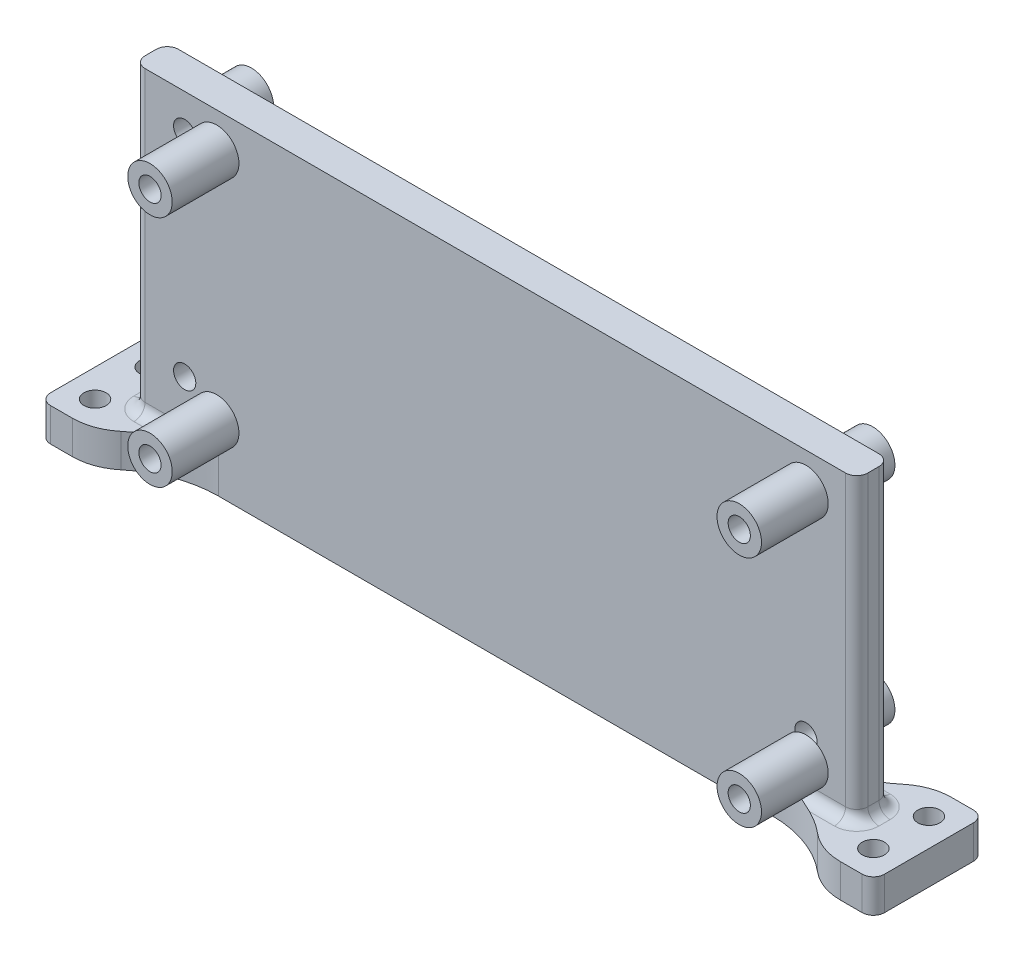
from build123d import *

# Parameters (mm, degrees)
SKETCH2_W           = 65
SKETCH2_H           = 30.000000000000004
BOSS_EXTRUDE1_DEPTH = 3
SKETCH3_R           = 0.9999999999999981
SKETCH3_R_2         = 0.9999999999999983
SKETCH3_R_3         = 1.0000000000000002
BOSS_EXTRUDE2_DEPTH = 3
FILLET1_R           = 10
FILLET2_R           = 1
FILLET3_R           = 1
FILLET4_R           = 5
SKETCH4_R           = 1.0000000000000004
SKETCH4_R_2         = 0.9999999999999983
CUT_EXTRUDE1_DEPTH  = 10
BOSS_EXTRUDE3_START = 3
SKETCH5_R           = 2.000000000000001
SKETCH5_R_2         = 1.0000000000000004
SKETCH5_R_3         = 2.0000000000000004
SKETCH5_R_4         = 1.0000000000000009
SKETCH5_R_5         = 2.0000000000000036
SKETCH5_R_6         = 1.000000000000005
SKETCH5_R_7         = 2.0000000000000027
SKETCH5_R_8         = 0.9999999999999983
BOSS_EXTRUDE3_DEPTH = 3
SKETCH6_R           = 2.0000000000000036
SKETCH6_R_2         = 0.9999999999999983
SKETCH6_R_3         = 2.000000000000003
SKETCH6_R_4         = 0.9999999999999981
SKETCH6_R_5         = 2
SKETCH6_R_6         = 1.0000000000000018
SKETCH6_R_7         = 1.9999999999999987
SKETCH6_R_8         = 1.0000000000000007
BOSS_EXTRUDE4_DEPTH = 6


with BuildPart() as part:
    # Sketch2 → Boss-Extrude1 (new body)
    with BuildSketch(Plane.XY):
        with Locations((32.5, 15.000000000000002)):
            Rectangle(SKETCH2_W, SKETCH2_H)
    extrude(amount=BOSS_EXTRUDE1_DEPTH)

    # Sketch3 → Boss-Extrude2 (add)
    # profile 1 of 2: a face of its own
    with BuildSketch(Plane.XZ):
        Polygon((65, 1.5), (65, 6.500000000000001), (70, 6.500000000000001), (70, -3.4999999999999996), (65, -3.4999999999999996), align=None)
        with Locations(Location((67.5, 4, 0), (0, 0, 270))):
            Circle(SKETCH3_R, mode=Mode.SUBTRACT)
        with Locations(Location((67.5, -1, 0), (0, 0, 270))):
            Circle(SKETCH3_R_2, mode=Mode.SUBTRACT)
    # profile 2 of 2: a face of its own
    with BuildSketch(Plane.XZ):
        Polygon((-5, 1.4999999999999993), (-5, 6.5), (0, 6.5), (0, -3.5000000000000013), (-5, -3.5000000000000018), align=None)
        with Locations(Location((-2.5, 3.999999999999999, 0), (0, 0, 270))):
            Circle(SKETCH3_R_3, mode=Mode.SUBTRACT)
        with Locations(Location((-2.5, -1.0000000000000018, 0), (0, 0, 270))):
            Circle(SKETCH3_R_3, mode=Mode.SUBTRACT)
    extrude(amount=-BOSS_EXTRUDE2_DEPTH)

    # Fillet1
    # the kernel refuses this fillet: 10 mm, written as the material it adds along each edge
    with BuildSketch(Plane(origin=(65, 3, 3), x_dir=(-1, 0, 0), z_dir=(0, -1, 0))) as fillet1_piece_1:
        with BuildLine():
            CenterArc((7.599342076785334, -10), FILLET1_R, 90, 49.458398126495496)
            Line((0, -3.500000000000001), (0, 0))
            Line((0, 0), (7.599342076785334, 0))
        make_face()
    extrude(amount=3)
    with BuildSketch(Plane(origin=(65, 3, 0), x_dir=(-1, 0, 0), z_dir=(0, -1, 0))) as fillet1_piece_2:
        with BuildLine():
            CenterArc((7.599342076785334, 10), FILLET1_R, 220.5416018735045, 49.45839812649547)
            Line((0, 3.500000000000001), (0, 0))
            Line((0, 0), (7.599342076785334, 0))
        make_face()
    extrude(amount=3)
    with BuildSketch(Plane(origin=(0, 0, 0), x_dir=(1, 0, 0), z_dir=(0, 1, 0))) as fillet1_piece_3:
        with BuildLine():
            CenterArc((7.599342076785334, 10), FILLET1_R, 220.5416018735045, 49.45839812649547)
            Line((0, 3.5000000000000018), (0, 0))
            Line((0, 0), (7.599342076785334, 0))
        make_face()
    extrude(amount=3)
    with BuildSketch(Plane(origin=(0, 0, 3), x_dir=(1, 0, 0), z_dir=(0, 1, 0))) as fillet1_piece_4:
        with BuildLine():
            CenterArc((7.59934207678533, -10), FILLET1_R, 90, 49.45839812649547)
            Line((-1.78e-15, -3.4999999999999982), (0, 0))
            Line((0, 0), (7.59934207678533, 0))
        make_face()
    extrude(amount=3)

    # Fillet2
    fillet2_edges = [part.edges().sort_by_distance(p)[0] for p in [
        (70, 1.5, 6.500000000000001),
        (70, 1.5, -3.4999999999999996),
        (-5, 1.5, -3.5000000000000018),
        (-5, 1.5, 6.5),
    ]]
    fillet(fillet2_edges, radius=FILLET2_R)

    # Fillet3
    fillet3_edges = [part.edges().sort_by_distance(p)[0] for p in [
        (0, 3, 1.5),
        (65, 16.5, 0),
        (65, 16.5, 3),
        (65, 3, 1.5),
        (0, 16.5, 3),
        (0, 16.5, 0),
        (3.7996710383925, 3, 3),
        (61.2003289616075, 3, 3),
        (3.7996710383925, 3, 0),
        (61.2003289616075, 3, 0),
    ]]
    fillet(fillet3_edges, radius=FILLET3_R)

    # Fillet4
    fillet4_edges = [part.edges().sort_by_distance(p)[0] for p in [
        (65, 1.5, -3.4999999999999996),
        (65, 1.5, 6.500000000000001),
        (0, 1.5, 6.5),
        (0, 1.5, -3.5000000000000013),
    ]]
    fillet(fillet4_edges, radius=FILLET4_R)

    # Sketch4 → Cut-Extrude1 (cut)
    with BuildSketch(Plane(origin=(0, 0, 0), x_dir=(-1, 0, 0), z_dir=(0, 0, -1))):
        with Locations((-4.559999999999932, 26.825000000000006)):
            Circle(SKETCH4_R)
        with Locations((-60.439999999999934, 26.825000000000006)):
            Circle(SKETCH4_R_2)
        with Locations((-60.439999999999934, 7.775000000000004)):
            Circle(SKETCH4_R_2)
        with Locations((-4.559999999999932, 7.775000000000004)):
            Circle(SKETCH4_R)
    extrude(amount=-CUT_EXTRUDE1_DEPTH, mode=Mode.SUBTRACT)

    # Sketch5 → Boss-Extrude3 (add)
    # profile 1 of 4: a face of its own
    with BuildSketch(Plane(origin=(0, 0, 0), x_dir=(-1, 0, 0), z_dir=(0, 0, -1)).offset(BOSS_EXTRUDE3_START)):
        with Locations((-4.559999999999932, 26.825000000000006)):
            Circle(SKETCH5_R)
        with Locations((-4.559999999999932, 26.825000000000006)):
            Circle(SKETCH5_R_2, mode=Mode.SUBTRACT)
    # profile 2 of 4: a face of its own
    with BuildSketch(Plane(origin=(0, 0, 0), x_dir=(-1, 0, 0), z_dir=(0, 0, -1)).offset(BOSS_EXTRUDE3_START)):
        with Locations((-4.559999999999932, 7.775000000000004)):
            Circle(SKETCH5_R_3)
        with Locations((-4.559999999999932, 7.775000000000004)):
            Circle(SKETCH5_R_4, mode=Mode.SUBTRACT)
    # profile 3 of 4: a face of its own
    with BuildSketch(Plane(origin=(0, 0, 0), x_dir=(-1, 0, 0), z_dir=(0, 0, -1)).offset(BOSS_EXTRUDE3_START)):
        with Locations((-60.439999999999934, 26.825000000000006)):
            Circle(SKETCH5_R_5)
        with Locations((-60.439999999999934, 26.825000000000006)):
            Circle(SKETCH5_R_6, mode=Mode.SUBTRACT)
    # profile 4 of 4: a face of its own
    with BuildSketch(Plane(origin=(0, 0, 0), x_dir=(-1, 0, 0), z_dir=(0, 0, -1)).offset(BOSS_EXTRUDE3_START)):
        with Locations((-60.439999999999934, 7.775000000000004)):
            Circle(SKETCH5_R_7)
        with Locations((-60.439999999999934, 7.775000000000004)):
            Circle(SKETCH5_R_8, mode=Mode.SUBTRACT)
    extrude(amount=-BOSS_EXTRUDE3_DEPTH)

    # Sketch6 → Boss-Extrude4 (add)
    # profile 1 of 4: a face of its own
    with BuildSketch(Plane.XY.offset(3)):
        with Locations(Location((60.439999999999934, 26.825000000000006, 0), (0, 0, 180))):
            Circle(SKETCH6_R)
        with Locations(Location((60.439999999999934, 26.825000000000006, 0), (0, 0, 180))):
            Circle(SKETCH6_R_2, mode=Mode.SUBTRACT)
    # profile 2 of 4: a face of its own
    with BuildSketch(Plane.XY.offset(3)):
        with Locations(Location((60.439999999999934, 5.825000000000004, 0), (0, 0, 119.294600838))):
            Circle(SKETCH6_R_3)
        with Locations(Location((60.439999999999934, 5.825000000000004, 0), (0, 0, 102.838568141))):
            Circle(SKETCH6_R_4, mode=Mode.SUBTRACT)
    # profile 3 of 4: a face of its own
    with BuildSketch(Plane.XY.offset(3)):
        with Locations(Location((7.439999999999933, 26.825, 0), (0, 0, 191.357748332))):
            Circle(SKETCH6_R_5)
        with Locations((7.439999999999933, 26.825)):
            Circle(SKETCH6_R_6, mode=Mode.SUBTRACT)
    # profile 4 of 4: a face of its own
    with BuildSketch(Plane.XY.offset(3)):
        with Locations(Location((7.4399999999999356, 5.824999999999997, 0), (0, 0, 245.853152003))):
            Circle(SKETCH6_R_7)
        with Locations((7.4399999999999356, 5.824999999999997)):
            Circle(SKETCH6_R_8, mode=Mode.SUBTRACT)
    extrude(amount=BOSS_EXTRUDE4_DEPTH)


solid = part.part
